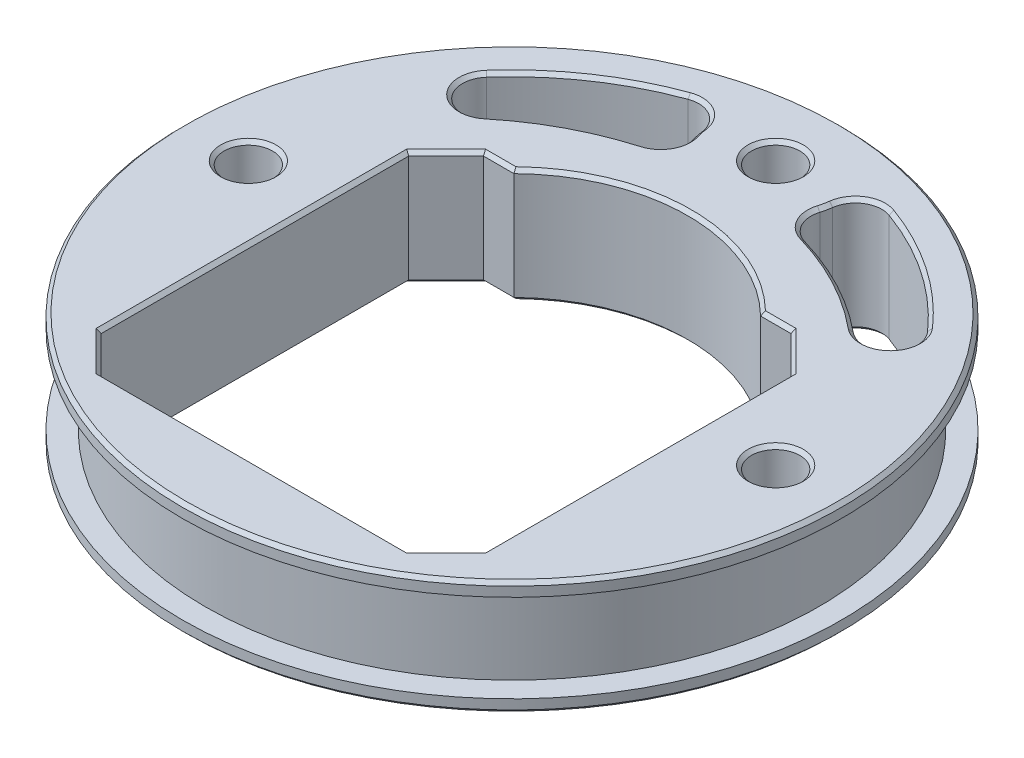
from build123d import *

# Parameters (mm, degrees)
SKETCH1_R               = 37.5
SKETCH1_R_2             = 2.75
BOSS_EXTRUDE1_DEPTH     = 6.5
SKETCH2_R               = 44.9
SKETCH2_R_2             = 34.9
CUT_EXTRUDE_THIN1_DEPTH = 5
CHAMFER1_SIZE           = 0.4
CHAMFER2_SIZE           = 0.4


with BuildPart() as part:
    # Sketch1 → Boss-Extrude1 (new, symmetric)
    with BuildSketch(Plane(origin=(0, 0, 0), x_dir=(1, 0, 0), z_dir=(0, 1, 0))):
        Circle(SKETCH1_R)
        with Locations((0, 30)):
            Circle(SKETCH1_R_2, mode=Mode.SUBTRACT)
        with Locations((30, 0)):
            Circle(SKETCH1_R_2, mode=Mode.SUBTRACT)
        with Locations((-30, 0)):
            Circle(SKETCH1_R_2, mode=Mode.SUBTRACT)
        with BuildLine():
            Line((-17.494426356, 14.25), (-14.033442201, 14.25))
            ThreePointArc((-14.033442201, 14.25), (0, 20), (14.033442201, 14.25))
            Line((14.033442201, 14.25), (17.494426356, 14.25))
            Line((17.494426356, 14.25), (21.75, 9.994426356))
            Line((21.75, 9.994426356), (21.75, -24.994426356))
            Line((21.75, -24.994426356), (17.494426356, -29.25))
            Line((17.494426356, -29.25), (-17.494426356, -29.25))
            Line((-17.494426356, -29.25), (-21.75, -24.994426356))
            Line((-21.75, -24.994426356), (-21.75, 9.994426356))
            Line((-21.75, 9.994426356), (-17.494426356, 14.25))
        make_face(mode=Mode.SUBTRACT)
        with BuildLine():
            ThreePointArc((7.182286097, 27.840192967), (7.335670337, 28.438609369), (7.439285619, 29.047619048))
            ThreePointArc((7.439285619, 29.047619048), (8.853359783, 31.228166276), (11.439426083, 31.486338798))
            ThreePointArc((11.439426083, 31.486338798), (18.843045333, 27.698188435), (25.085377879, 22.203013684))
            ThreePointArc((25.085377879, 22.203013684), (24.997326571, 18.131103641), (20.931054397, 17.899511222))
            ThreePointArc((20.931054397, 17.899511222), (15.388292289, 21.593722157), (9.215229657, 24.09626166))
            ThreePointArc((9.215229657, 24.09626166), (7.418794885, 25.54470973), (7.182286097, 27.840192967))
        make_face(mode=Mode.SUBTRACT)
        with BuildLine():
            ThreePointArc((-25.085377879, 22.203013684), (-24.997326571, 18.131103641), (-20.931054397, 17.899511222))
            ThreePointArc((-20.931054397, 17.899511222), (-15.388292289, 21.593722157), (-9.215229657, 24.09626166))
            ThreePointArc((-9.215229657, 24.09626166), (-7.418794885, 25.54470973), (-7.182286097, 27.840192967))
            ThreePointArc((-7.182286097, 27.840192967), (-7.335670337, 28.438609369), (-7.439285619, 29.047619048))
            ThreePointArc((-7.439285619, 29.047619048), (-8.853359783, 31.228166276), (-11.439426083, 31.486338798))
            ThreePointArc((-11.439426083, 31.486338798), (-18.843045333, 27.698188435), (-25.085377879, 22.203013684))
        make_face(mode=Mode.SUBTRACT)
    extrude(amount=BOSS_EXTRUDE1_DEPTH, both=True)

    # Sketch2 → Cut-Extrude-Thin1 (cut, symmetric)
    with BuildSketch(Plane(origin=(0, 0, 0), x_dir=(1, 0, 0), z_dir=(0, 1, 0))):
        Circle(SKETCH2_R)
        Circle(SKETCH2_R_2, mode=Mode.SUBTRACT)
    extrude(amount=CUT_EXTRUDE_THIN1_DEPTH, both=True, mode=Mode.SUBTRACT)

    # Chamfer1
    chamfer1_edges = [part.edges().sort_by_distance(p)[0] for p in [
        (-37.5, -6.5, 0),
        (-37.5, 6.5, 0),
    ]]
    chamfer(chamfer1_edges, length=CHAMFER1_SIZE)

    # Chamfer2
    chamfer2_edges = [part.edges().sort_by_distance(p)[0] for p in [
        (-15.763934278, -6.5, -14.25),
        (0, -6.5, -20),
        (15.763934278, -6.5, -14.25),
        (19.622213178, -6.5, -12.122213178),
        (21.75, -6.5, 7.5),
        (19.622213178, -6.5, 27.122213178),
        (0, -6.5, 29.25),
        (-19.622213178, -6.5, 27.122213178),
        (-21.75, -6.5, 7.5),
        (-19.622213178, -6.5, -12.122213178),
        (27.25, -6.5, 0),
        (27.25, 6.5, 0),
        (-32.75, -6.5, 0),
        (-32.75, 6.5, 0),
        (-2.75, -6.5, -30),
        (-2.75, 6.5, -30),
        (-15.388292289, 6.5, -21.593722157),
        (-7.418794885, 6.5, -25.54470973),
        (-24.997326571, 6.5, -18.131103641),
        (-7.335670337, 6.5, -28.438609369),
        (-18.843045333, 6.5, -27.698188435),
        (-8.853359783, 6.5, -31.228166276),
        (-15.388292289, -6.5, -21.593722157),
        (-7.418794885, -6.5, -25.54470973),
        (-24.997326571, -6.5, -18.131103641),
        (-7.335670337, -6.5, -28.438609369),
        (-18.843045333, -6.5, -27.698188435),
        (-8.853359783, -6.5, -31.228166276),
        (7.418794885, 6.5, -25.54470973),
        (15.388292289, 6.5, -21.593722157),
        (7.335670337, 6.5, -28.438609369),
        (24.997326571, 6.5, -18.131103641),
        (8.853359783, 6.5, -31.228166276),
        (18.843045333, 6.5, -27.698188435),
        (7.418794885, -6.5, -25.54470973),
        (15.388292289, -6.5, -21.593722157),
        (7.335670337, -6.5, -28.438609369),
        (24.997326571, -6.5, -18.131103641),
        (8.853359783, -6.5, -31.228166276),
        (18.843045333, -6.5, -27.698188435),
        (15.763934278, 6.5, -14.25),
        (19.622213178, 6.5, -12.122213178),
        (21.75, 6.5, 7.5),
        (19.622213178, 6.5, 27.122213178),
        (0, 6.5, 29.25),
        (-19.622213178, 6.5, 27.122213178),
        (-21.75, 6.5, 7.5),
        (-19.622213178, 6.5, -12.122213178),
        (0, 6.5, -20),
        (-15.763934278, 6.5, -14.25),
    ]]
    chamfer(chamfer2_edges, length=CHAMFER2_SIZE)


solid = part.part
